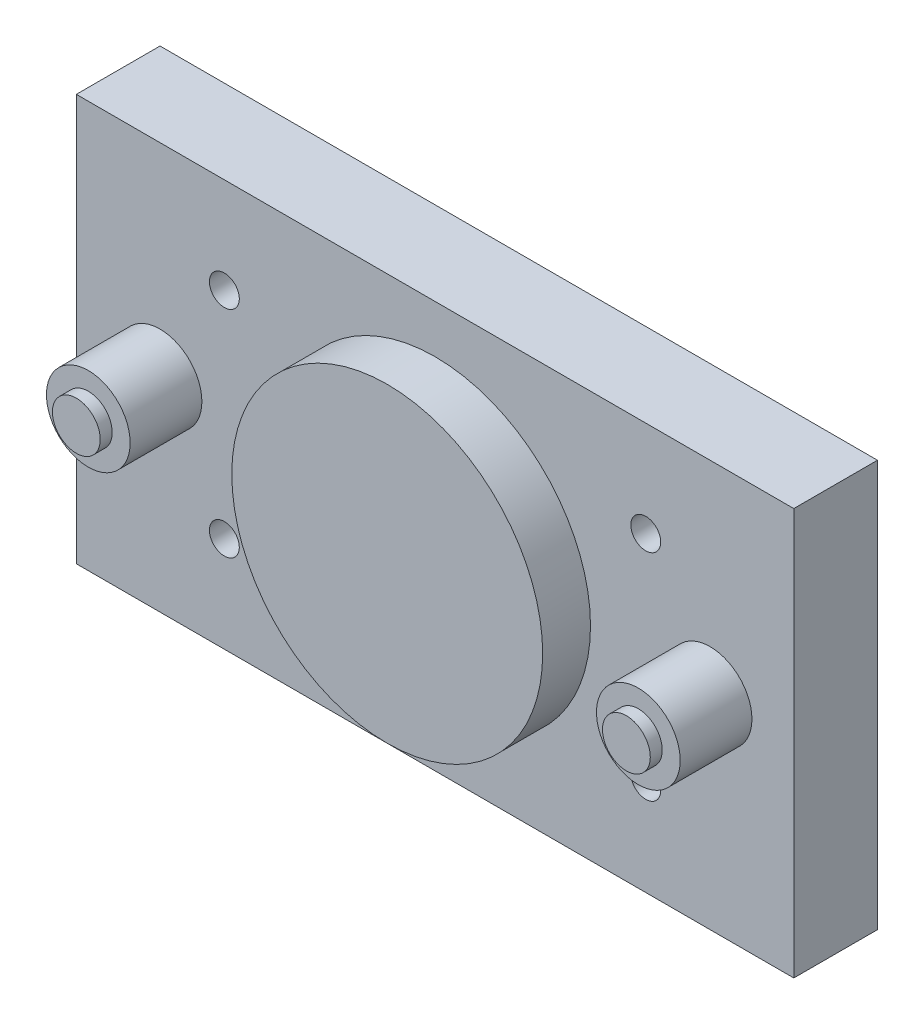
from build123d import *

# Parameters (mm, degrees)
SKETCH1_W                = 60
SKETCH1_H                = 34
BOSS_EXTRUDE1_DEPTH      = 7
SKETCH6_R                = 2
SKETCH6_R_2              = 13
CUT_EXTRUDE4_DEPTH       = 5
CUT_EXTRUDE6_DEPTH       = 3
SKETCH10_R               = 3.5
BOSS_EXTRUDE5_DEPTH      = 6
SKETCH11_R               = 2
CUT_EXTRUDE7_DEPTH       = 7
CUT_EXTRUDE8_START       = -5
CUT_EXTRUDE8_DEPTH       = 5
CUT_EXTRUDE9_DEPTH       = 36.185224172
CUT_EXTRUDE9_DEPTH_BACK  = 36.185224172
SKETCH13_R               = 1.25
CUT_EXTRUDE10_DEPTH      = 36.185224172
CUT_EXTRUDE10_DEPTH_BACK = 36.185224172
SKETCH14_R               = 1.25
CUT_EXTRUDE11_DEPTH      = 36.185224172
CUT_EXTRUDE11_DEPTH_BACK = 36.185224172
SKETCH15_R               = 1.25
CUT_EXTRUDE12_DEPTH      = 36.185224172
CUT_EXTRUDE12_DEPTH_BACK = 36.185224172
SKETCH16_R               = 1.25
SKETCH17_R               = 2
BOSS_EXTRUDE6_DEPTH      = 1
BOSS_EXTRUDE6_2_DEPTH    = 1
SKETCH18_R               = 13
BOSS_EXTRUDE7_DEPTH      = 4
SKETCH19_R               = 12
CUT_EXTRUDE13_DEPTH      = 2
SKETCH20_W               = 13.5
SKETCH20_H               = 12.5
BOSS_EXTRUDE8_DEPTH      = 3.5


# Read off the part's stored shape, not the designer's step: Cut-Extrude8
with BuildPart() as part:
    # Sketch1 → Boss-Extrude1 (new body)
    with BuildSketch(Plane.XY):
        Rectangle(SKETCH1_W, SKETCH1_H)
    extrude(amount=BOSS_EXTRUDE1_DEPTH)

    # Sketch6 → Cut-Extrude4 (cut)
    with BuildSketch(Plane.XY.offset(7)):
        with Locations((-23, 0)):
            Circle(SKETCH6_R)
        with Locations((23, 0)):
            Circle(SKETCH6_R)
        Circle(SKETCH6_R_2)
    extrude(amount=-CUT_EXTRUDE4_DEPTH, mode=Mode.SUBTRACT)

    # Sketch9 → Cut-Extrude6 (cut)
    with BuildSketch(Plane.XY.offset(2)):
        Polygon((-21.845232579, 2), (-12.845232579, 2), (12.845232579, 2), (21.845232579, 2), (23, 2), (23, 0), (23, -2), (21.845232579, -2), (12.845232579, -2), (-12.845232579, -2), (-21.845232579, -2), (-23, -2), (-23, 0), (-23, 2), align=None)
    extrude(amount=CUT_EXTRUDE6_DEPTH, mode=Mode.SUBTRACT)

    # Sketch10 → Boss-Extrude5 (add)
    with BuildSketch(Plane.XY.offset(7)):
        with Locations((23, 0)):
            Circle(SKETCH10_R)
        with Locations((-23, 0)):
            Circle(SKETCH10_R)
    extrude(amount=BOSS_EXTRUDE5_DEPTH)

    # Sketch11 → Cut-Extrude7 (cut)
    with BuildSketch(Plane.XY.offset(13)):
        with Locations((-23, 0)):
            Circle(SKETCH11_R)
        with Locations((23, 0)):
            Circle(SKETCH11_R)
    extrude(amount=-CUT_EXTRUDE7_DEPTH, mode=Mode.SUBTRACT)

    # Cut-Extrude8 outline → Cut-Extrude8 (cut)
    with BuildSketch(Plane(origin=(0, 0, 0), x_dir=(-1, 0, 0), z_dir=(0, 0, -1)).offset(CUT_EXTRUDE8_START)):
        with BuildLine():
            Line((-8.185521436, 14), (-27, 14))
            Line((-27, 14), (-27, 6))
            Line((-27, 6), (-15.198684154, 6))
            ThreePointArc((-15.198684154, 6), (-12.357397289, 10.583227318), (-8.185521436, 14))
        make_face()
        with BuildLine():
            Line((-15.198684154, -6.499654852), (-27, -6.499654852))
            Line((-27, -6.499654852), (-27, -14.499654852))
            Line((-27, -14.499654852), (-8.185521436, -14.499654852))
            ThreePointArc((-8.185521436, -14.499654852), (-12.357397289, -11.08288217), (-15.198684154, -6.499654852))
        make_face()
        with BuildLine():
            Line((27, 6), (27, 14))
            Line((27, 14), (8.185521436, 14))
            ThreePointArc((8.185521436, 14), (12.357397289, 10.583227318), (15.198684154, 6))
            Line((15.198684154, 6), (27, 6))
        make_face()
        with BuildLine():
            ThreePointArc((15.198684154, -6.499654852), (12.357397289, -11.08288217), (8.185521436, -14.499654852))
            Line((8.185521436, -14.499654852), (27, -14.499654852))
            Line((27, -14.499654852), (27, -6.499654852))
            Line((27, -6.499654852), (15.198684154, -6.499654852))
        make_face()
    extrude(amount=CUT_EXTRUDE8_DEPTH, mode=Mode.SUBTRACT)

    # Sketch13 → Cut-Extrude9 (cut, two sides: drawn at the far end of the back side and taken through both)
    with BuildSketch(Plane.XY.offset(7).offset(-CUT_EXTRUDE9_DEPTH_BACK)):
        with Locations((17.620120435, -9)):
            Circle(SKETCH13_R)
    extrude(amount=CUT_EXTRUDE9_DEPTH + CUT_EXTRUDE9_DEPTH_BACK, mode=Mode.SUBTRACT)

    # Sketch14 → Cut-Extrude10 (cut, two sides: drawn at the far end of the back side and taken through both)
    with BuildSketch(Plane.XY.offset(7).offset(-CUT_EXTRUDE10_DEPTH_BACK)):
        with Locations((17.620120435, 9)):
            Circle(SKETCH14_R)
    extrude(amount=CUT_EXTRUDE10_DEPTH + CUT_EXTRUDE10_DEPTH_BACK, mode=Mode.SUBTRACT)

    # Sketch15 → Cut-Extrude11 (cut, two sides: drawn at the far end of the back side and taken through both)
    with BuildSketch(Plane.XY.offset(7).offset(-CUT_EXTRUDE11_DEPTH_BACK)):
        with Locations((-17.620120435, -9)):
            Circle(SKETCH15_R)
    extrude(amount=CUT_EXTRUDE11_DEPTH + CUT_EXTRUDE11_DEPTH_BACK, mode=Mode.SUBTRACT)

    # Sketch16 → Cut-Extrude12 (cut, two sides: drawn at the far end of the back side and taken through both)
    with BuildSketch(Plane.XY.offset(7).offset(-CUT_EXTRUDE12_DEPTH_BACK)):
        with Locations((-17.620120435, 9)):
            Circle(SKETCH16_R)
    extrude(amount=CUT_EXTRUDE12_DEPTH + CUT_EXTRUDE12_DEPTH_BACK, mode=Mode.SUBTRACT)

    # Sketch20 → Boss-Extrude8 (add)
    with BuildSketch(Plane.XY.offset(2)):
        Rectangle(SKETCH20_W, SKETCH20_H)
    extrude(amount=BOSS_EXTRUDE8_DEPTH)


with BuildPart() as body_2:
    # Sketch17 → Boss-Extrude6 (new body)
    with BuildSketch(Plane.XY.offset(13)):
        with Locations((-23, 0)):
            Circle(SKETCH17_R)
    extrude(amount=BOSS_EXTRUDE6_DEPTH)


with BuildPart() as body_3:
    # Sketch17 → Boss-Extrude6 2 (new body)
    with BuildSketch(Plane.XY.offset(13)):
        with Locations((23, 0)):
            Circle(SKETCH17_R)
    extrude(amount=BOSS_EXTRUDE6_2_DEPTH)


with BuildPart() as body_4:
    # Sketch18 → Boss-Extrude7 (new body)
    with BuildSketch(Plane.XY.offset(7)):
        Circle(SKETCH18_R)
    extrude(amount=BOSS_EXTRUDE7_DEPTH)

    # Sketch19 → Cut-Extrude13 (cut)
    with BuildSketch(Plane.XY.offset(7)):
        Circle(SKETCH19_R)
    extrude(amount=CUT_EXTRUDE13_DEPTH, mode=Mode.SUBTRACT)


solid = Compound([part.part, body_2.part, body_3.part, body_4.part])
